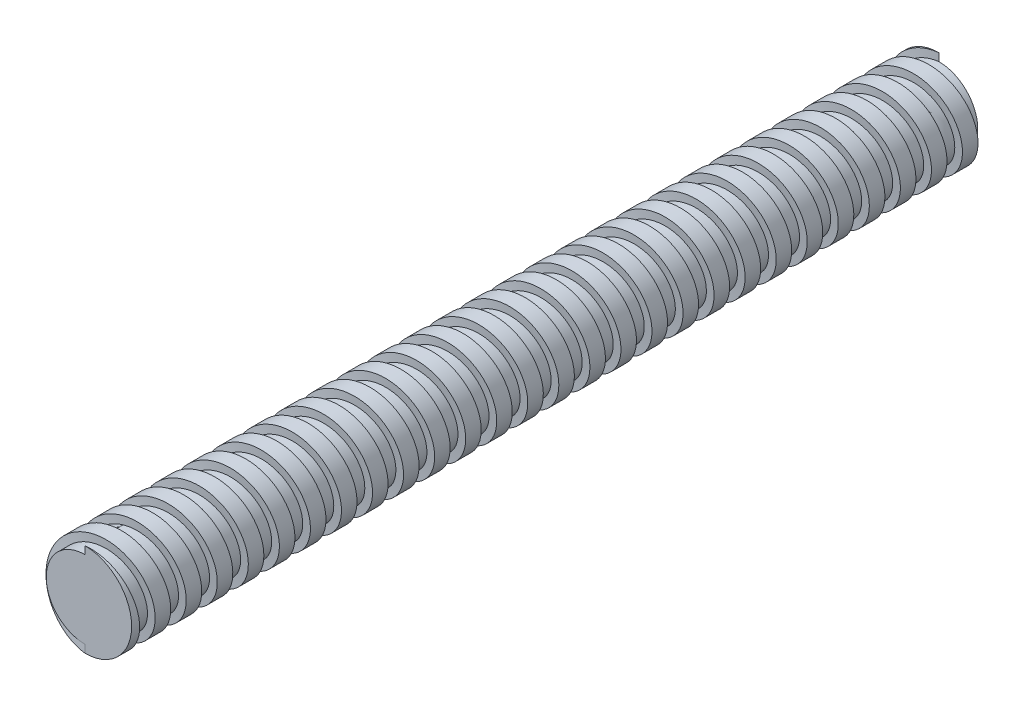
from build123d import *

# Parameters (mm, degrees)
SKETCH1_R           = 3
BOSS_EXTRUDE1_DEPTH = 55
CUT_SWEEP1_PITCH    = 2


with BuildPart() as part:
    # Sketch1 → Boss-Extrude1 (new body)
    with BuildSketch(Plane.XY):
        Circle(SKETCH1_R)
    extrude(amount=BOSS_EXTRUDE1_DEPTH)

    # Cut-Sweep1: arcs per turn and ends read off the stored shape
    # Cut-Sweep1: the profile of Sketch2 profile screwed along a right-hand helix through 29 turns, 10 arcs to a turn; built about Z, then put on its axis
    cut_sweep1_z = Axis((0, 0, 0), (0, 0, 1))
    cut_sweep1_corners = [(3.0003, 0, -1.5), (3.0003, 0, -2.5), (2.5, 0, -2.5), (2.5, 0, -1.5)]
    with BuildLine(mode=Mode.PRIVATE) as cut_sweep1_profile:
        Line(cut_sweep1_corners[0], cut_sweep1_corners[1])
        Line(cut_sweep1_corners[1], cut_sweep1_corners[2])
        Line(cut_sweep1_corners[2], cut_sweep1_corners[3])
        Line(cut_sweep1_corners[3], cut_sweep1_corners[0])
    cut_sweep1_cap = Face(cut_sweep1_profile.wire())
    cut_sweep1_turn_angles = [0, 18, 36, 54, 72, 90, 108, 126, 144, 162, 180, 198, 216, 234, 252, 270, 288, 306, 324, 342, 360]
    cut_sweep1_turn_weights = [1, 0.9510565162951535, 1, 0.9510565162951535, 1, 0.9510565162951535, 1, 0.9510565162951535, 1, 0.9510565162951535, 1, 0.9510565162951535, 1, 0.9510565162951535, 1, 0.9510565162951535, 1, 0.9510565162951535, 1, 0.9510565162951535, 1]
    cut_sweep1_turn_rails = [Edge.make_bspline([Vector(p[0], p[1], 0).rotate(cut_sweep1_z, cut_sweep1_turn_angles[k]) / cut_sweep1_turn_weights[k] + Vector(0, 0, p[2] + CUT_SWEEP1_PITCH * cut_sweep1_turn_angles[k] / 360) for k in range(21)], [0, 0, 0, 1, 1, 2, 2, 3, 3, 4, 4, 5, 5, 6, 6, 7, 7, 8, 8, 9, 9, 10, 10, 10], 2, cut_sweep1_turn_weights) for p in cut_sweep1_corners]
    cut_sweep1_turn_sides = [Face.make_surface_from_curves(cut_sweep1_turn_rails[p[0]], cut_sweep1_turn_rails[p[1]]) for p in [(0, 1), (1, 2), (2, 3), (3, 0)]]
    cut_sweep1 = Plane(origin=(0, 0, 0), x_dir=(1, 0, 0), z_dir=(0, 0, 1)) * Solid(Shell([*[p.moved(Location((0, 0, CUT_SWEEP1_PITCH * i))) for i in range(29) for p in cut_sweep1_turn_sides], cut_sweep1_cap, cut_sweep1_cap.rotate(cut_sweep1_z, 10440).moved(Location((0, 0, CUT_SWEEP1_PITCH * 10440 / 360)))]))
    add(cut_sweep1, mode=Mode.SUBTRACT)


solid = part.part
